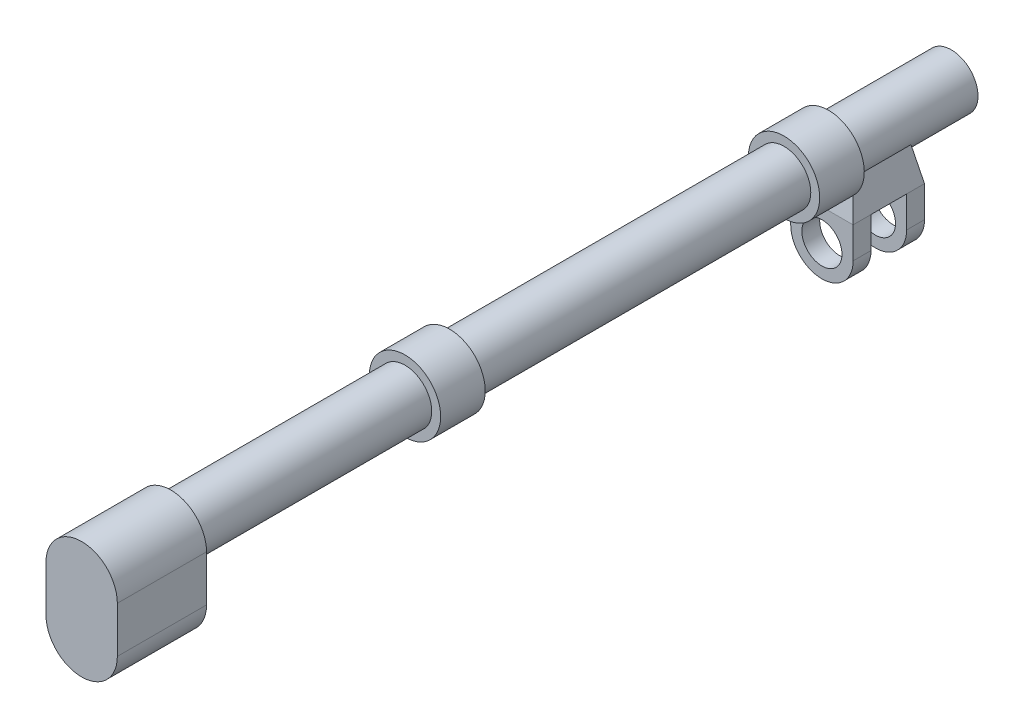
from build123d import *

# Parameters (mm, degrees)
SKETCH1_R           = 6
BOSS_EXTRUDE1_DEPTH = 97.5
SKETCH4_W           = 14
SKETCH4_H           = 4
BOSS_EXTRUDE2_DEPTH = 14
SKETCH5_R           = 4.5
CUT_EXTRUDE1_DEPTH  = 4
CUT_EXTRUDE2_START  = -4
SKETCH6_R           = 4.5
CUT_EXTRUDE2_DEPTH  = 4
CUT_EXTRUDE3_DEPTH  = 168.871975132
SKETCH8_R           = 8
BOSS_EXTRUDE3_DEPTH = 5
SKETCH9_R           = 6
BOSS_EXTRUDE4_DEPTH = 20
BOSS_EXTRUDE5_START = 10
SKETCH11_R          = 8
BOSS_EXTRUDE5_DEPTH = 10


with BuildPart() as part:
    # Sketch1 → Boss-Extrude1 (new, symmetric)
    with BuildSketch(Plane.XY):
        Circle(SKETCH1_R)
    extrude(amount=BOSS_EXTRUDE1_DEPTH, both=True)

    # Sketch2 → Loft1 section 0
    with BuildSketch(Plane(origin=(0, 0, 0), x_dir=(1, 0, 0), z_dir=(0, 1, 0))):
        with BuildLine():
            Line((-5, 82.5), (5, 82.5))
            Line((5, 82.5), (5, 70.5))
            Line((5, 70.5), (-5, 70.5))
            Line((-5, 70.5), (-5, 82.5))
        make_face()
    # Sketch3 → Loft1 section 1
    with BuildSketch(Plane(origin=(0, -10, 0), x_dir=(-1, 0, 0), z_dir=(0, 1, 0))):
        with BuildLine():
            Line((-7, -68.5), (7, -68.5))
            Line((7, -68.5), (7, -84.5))
            Line((7, -84.5), (-7, -84.5))
            Line((-7, -84.5), (-7, -68.5))
        make_face()
    loft()

    # Sketch4 → Boss-Extrude2 (add)
    with BuildSketch(Plane.XZ.offset(10)):
        with Locations((0, -70.5)):
            Rectangle(SKETCH4_W, SKETCH4_H)
        with Locations((0, -82.5)):
            Rectangle(SKETCH4_W, SKETCH4_H)
    extrude(amount=BOSS_EXTRUDE2_DEPTH)

    # Sketch5 → Cut-Extrude1 (cut)
    with BuildSketch(Plane(origin=(0, 0, -72.5), x_dir=(-1, 0, 0), z_dir=(0, 0, -1))):
        with Locations((0, -17)):
            Circle(SKETCH5_R)
    extrude(amount=-CUT_EXTRUDE1_DEPTH, mode=Mode.SUBTRACT)

    # Sketch6 → Cut-Extrude2 (cut)
    with BuildSketch(Plane.XY.offset(-80.5).offset(CUT_EXTRUDE2_START)):
        with Locations((0, -17)):
            Circle(SKETCH6_R)
    extrude(amount=CUT_EXTRUDE2_DEPTH, mode=Mode.SUBTRACT)

    # Sketch7 → Cut-Extrude3 (cut, through all)
    with BuildSketch(Plane.XY.offset(-68.5)):
        with BuildLine():
            ThreePointArc((0, -24), (-4.949747468, -21.949747468), (-7, -17))
            Line((-7, -17), (-7, -24))
            Line((-7, -24), (0, -24))
        make_face()
        with BuildLine():
            ThreePointArc((7, -17), (4.949747468, -21.949747468), (0, -24))
            Line((0, -24), (7, -24))
            Line((7, -24), (7, -17))
        make_face()
    extrude(amount=-CUT_EXTRUDE3_DEPTH, mode=Mode.SUBTRACT)

    # Sketch8 → Boss-Extrude3 (add, symmetric)
    with BuildSketch(Plane.XY.offset(-65)):
        Circle(SKETCH8_R)
    extrude(amount=BOSS_EXTRUDE3_DEPTH, both=True)

    # Sketch9 → Boss-Extrude4 (add)
    with BuildSketch(Plane.XY.offset(97.5)):
        with BuildLine():
            Line((8, -10.315788333), (8, 0))
            ThreePointArc((8, 0), (0, 8), (-8, 0))
            Line((-8, 0), (-8, -10.315788333))
            ThreePointArc((-8, -10.315788333), (0, -18.315788333), (8, -10.315788333))
        make_face()
        Circle(SKETCH9_R, mode=Mode.SUBTRACT)
    extrude(amount=-BOSS_EXTRUDE4_DEPTH)

    # Sketch11 → Boss-Extrude5 (add)
    with BuildSketch(Plane.XY.offset(15).offset(BOSS_EXTRUDE5_START)):
        Circle(SKETCH11_R)
    extrude(amount=-BOSS_EXTRUDE5_DEPTH)


solid = part.part
